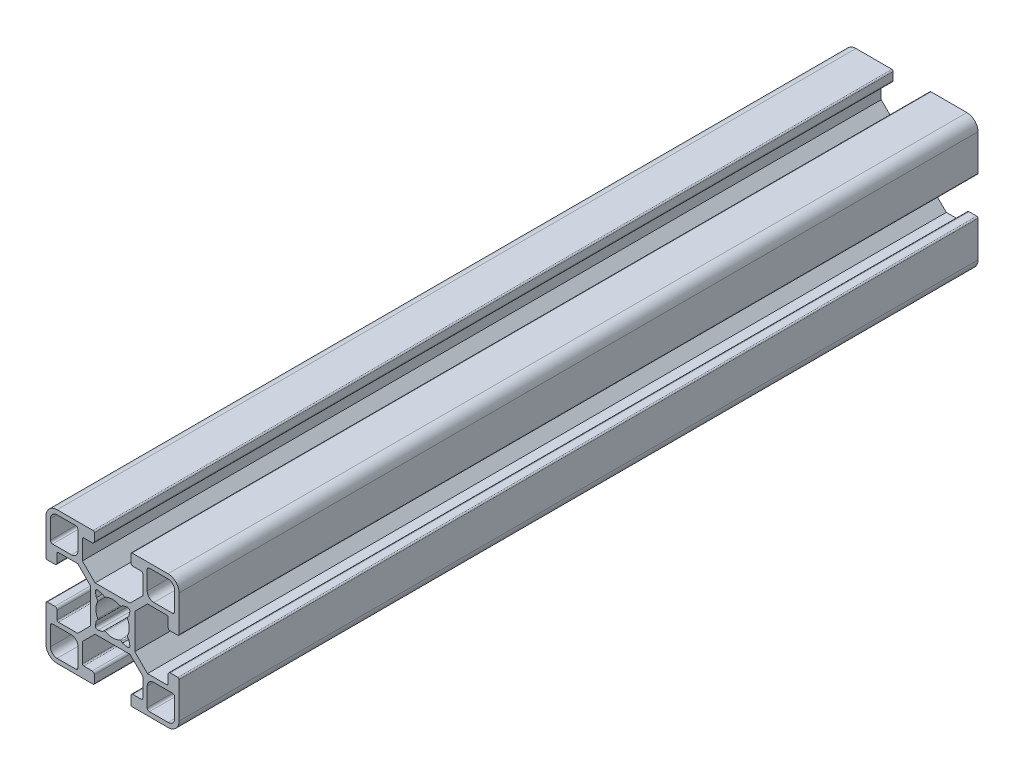
from build123d import *

# Parameters (mm, degrees)
BOSS_EXTRUDE1_DEPTH = 90


with BuildPart() as part:
    # Sketch1 → Boss-Extrude1 (new, symmetric)
    with BuildSketch(Plane.XY):
        with BuildLine():
            Line((21.799990977, 7.139350412), (18.939335294, 10.000004729))
            Line((18.939335294, 10.000004729), (11.060654294, 10.000000095))
            Line((11.060654294, 10.000000095), (8.200000977, 7.139342412))
            Line((8.200000977, 7.139342412), (8.200003529, 2.800001412))
            ThreePointArc((8.200003529, 2.800001412), (8.28786862, 2.587867672), (8.500000706, 2.499998588))
            Line((8.500000706, 2.499998588), (10.400000706, 2.499999706))
            ThreePointArc((10.400000706, 2.499999706), (10.753554287, 2.353553201), (10.900001, 1.999999706))
            Line((10.900001, 1.999999706), (10.900001, 0.299996823))
            ThreePointArc((10.900001, 0.299996823), (10.812134558, 0.087867732), (10.600006, 0))
            Line((10.600006, 0), (2.5, 0))
            ThreePointArc((2.5, 0), (0.732233047, 0.732233047), (0, 2.5))
            Line((0, 2.5), (0, 10.600006))
            ThreePointArc((0, 10.600006), (0.087869562, 10.812137388), (0.300003, 10.900002))
            Line((0.300003, 10.900002), (2, 10.900002))
            ThreePointArc((2, 10.900002), (2.353553391, 10.753555391), (2.5, 10.400002))
            Line((2.5, 10.400002), (2.5, 8.500002))
            ThreePointArc((2.5, 8.500002), (2.587869099, 8.287870075), (2.80000269, 8.200005))
            Line((2.80000269, 8.200005), (7.139344, 8.200005))
            Line((7.139344, 8.200005), (10, 11.06066))
            Line((10, 11.06066), (10, 18.939341))
            Line((10, 18.939341), (7.139344, 21.799995))
            Line((7.139344, 21.799995), (2.800003, 21.799995))
            ThreePointArc((2.800003, 21.799995), (2.587869208, 21.712130034), (2.5, 21.499998))
            Line((2.5, 21.499998), (2.5, 19.59999775))
            ThreePointArc((2.5, 19.59999775), (2.353553161, 19.246444027), (1.999999309, 19.0999975))
            Line((1.999999309, 19.0999975), (0.299996735, 19.099999))
            ThreePointArc((0.299996735, 19.099999), (0.087867778, 19.187865661), (2.65e-07, 19.399994265))
            Line((2.65e-07, 19.399994265), (2.65e-07, 27.500000265))
            ThreePointArc((2.65e-07, 27.500000265), (0.732233312, 29.267767218), (2.500000265, 30.000000265))
            Line((2.500000265, 30.000000265), (10.6000062, 30.000000265))
            ThreePointArc((10.6000062, 30.000000265), (10.812136906, 29.912130185), (10.900001, 29.699997))
            Line((10.900001, 29.699997), (10.900001, 28))
            ThreePointArc((10.900001, 28), (10.75355439, 27.646446609), (10.400001, 27.5))
            Line((10.400001, 27.5), (8.499999, 27.5))
            ThreePointArc((8.499999, 27.5), (8.287868368, 27.412130194), (8.200004, 27.19999731))
            Line((8.200004, 27.19999731), (8.200004, 22.860655))
            Line((8.200004, 22.860655), (11.060659, 20))
            Line((11.060659, 20), (18.93934, 20))
            Line((18.93934, 20), (21.799994, 22.860655))
            Line((21.799994, 22.860655), (21.799994, 27.199997))
            ThreePointArc((21.799994, 27.199997), (21.712129034, 27.412130792), (21.499997, 27.5))
            Line((21.499997, 27.5), (19.599981706, 27.5))
            ThreePointArc((19.599981706, 27.5), (19.246428419, 27.646446505), (19.099981706, 27.999999706))
            Line((19.099981706, 27.999999706), (19.099980706, 29.700007823))
            ThreePointArc((19.099980706, 29.700007823), (19.187847107, 29.912137435), (19.399976029, 30.0000055))
            Line((19.399976029, 30.0000055), (27.499982029, 30.0000055))
            ThreePointArc((27.499982029, 30.0000055), (29.267764732, 29.267777107), (30.0000055, 27.499999529))
            Line((30.0000055, 27.499999529), (30.0000055, 19.399993594))
            ThreePointArc((30.0000055, 19.399993594), (29.912142492, 19.187844223), (29.6999965, 19.099973058))
            Line((29.6999965, 19.099973058), (27.9999995, 19.099974558))
            ThreePointArc((27.9999995, 19.099974558), (27.646437821, 19.246429455), (27.4999995, 19.599998))
            Line((27.4999995, 19.599998), (27.4999995, 21.5))
            ThreePointArc((27.4999995, 21.5), (27.412129694, 21.712130632), (27.19999681, 21.799995))
            Line((27.19999681, 21.799995), (22.8606545, 21.799995))
            Line((22.8606545, 21.799995), (19.9999995, 18.939341))
            Line((19.9999995, 18.939341), (19.9999995, 11.06066))
            Line((19.9999995, 11.06066), (22.8606545, 8.200005))
            Line((22.8606545, 8.200005), (27.1999965, 8.200005))
            ThreePointArc((27.1999965, 8.200005), (27.412129603, 8.287869277), (27.4999995, 8.500000051))
            Line((27.4999995, 8.500000051), (27.4999995, 10.400002))
            ThreePointArc((27.4999995, 10.400002), (27.646446109, 10.753555391), (27.9999995, 10.900002))
            Line((27.9999995, 10.900002), (29.7000025, 10.900002))
            ThreePointArc((29.7000025, 10.900002), (29.912129264, 10.812133269), (29.999995, 10.600005265))
            Line((29.999995, 10.600005265), (29.999995, 2.499999265))
            ThreePointArc((29.999995, 2.499999265), (29.26776322, 0.732236385), (27.500000177, 5e-06))
            Line((27.500000177, 5e-06), (19.399994245, 5e-06))
            ThreePointArc((19.399994245, 5e-06), (19.187862761, 0.087874413), (19.099998, 0.300007824))
            Line((19.099998, 0.300007824), (19.099997, 2.000004824))
            ThreePointArc((19.099997, 2.000004824), (19.246443401, 2.3535583), (19.599996706, 2.500005118))
            Line((19.599996706, 2.500005118), (21.499998706, 2.500006235))
            ThreePointArc((21.499998706, 2.500006235), (21.712129286, 2.587876166), (21.799993529, 2.800009102))
            Line((21.799993529, 2.800009102), (21.799990977, 7.139350412))
        make_face()
        with BuildLine():
            Line((18.878868942, 11.714100014), (18.657285002, 12.75690673))
            Line((18.657285002, 12.75690673), (18.419345869, 12.994846743))
            ThreePointArc((18.419345869, 12.994846743), (18.335473622, 13.158180995), (18.362480424, 13.339793948))
            ThreePointArc((18.362480424, 13.339793948), (18.750006156, 14.99998656), (18.362487962, 16.660180933))
            ThreePointArc((18.362487962, 16.660180933), (18.335481889, 16.841794157), (18.419354758, 17.005128271))
            Line((18.419354758, 17.005128271), (18.657294593, 17.243067582))
            Line((18.657294593, 17.243067582), (18.878893628, 18.28587109))
            ThreePointArc((18.878893628, 18.28587109), (18.743367928, 18.743355263), (18.285883756, 18.878880962))
            Line((18.285883756, 18.878880962), (17.243080247, 18.657281928))
            Line((17.243080247, 18.657281928), (17.005140412, 18.419342617))
            ThreePointArc((17.005140412, 18.419342617), (16.84180664, 18.335470316), (16.660194009, 18.362476539))
            ThreePointArc((16.660194009, 18.362476539), (15.00000526, 18.749996344), (13.339816433, 18.362476869))
            ThreePointArc((13.339816433, 18.362476869), (13.158203164, 18.335470716), (12.994869031, 18.419343671))
            Line((12.994869031, 18.419343671), (12.756929898, 18.657283684))
            Line((12.756929898, 18.657283684), (11.714126233, 18.878881984))
            ThreePointArc((11.714126233, 18.878881984), (11.256641967, 18.743355772), (11.121116891, 18.28587117))
            Line((11.121116891, 18.28587117), (11.342717777, 17.243068055))
            Line((11.342717777, 17.243068055), (11.580656587, 17.00512772))
            ThreePointArc((11.580656587, 17.00512772), (11.664528478, 16.841794182), (11.637522309, 16.660181943))
            ThreePointArc((11.637522309, 16.660181943), (11.250003617, 14.999998075), (11.637519652, 13.339813587))
            ThreePointArc((11.637519652, 13.339813587), (11.664525497, 13.15820068), (11.580652734, 12.994866901))
            Line((11.580652734, 12.994866901), (11.342712898, 12.75692759))
            Line((11.342712898, 12.75692759), (11.12111194, 11.71412449))
            ThreePointArc((11.12111194, 11.71412449), (11.256636795, 11.256640068), (11.714120718, 11.121113524))
            Line((11.714120718, 11.121113524), (12.756924635, 11.342710635))
            Line((12.756924635, 11.342710635), (12.99486447, 11.580649946))
            ThreePointArc((12.99486447, 11.580649946), (13.158198441, 11.66452228), (13.339811235, 11.637515845))
            ThreePointArc((13.339811235, 11.637515845), (14.999988879, 11.249993804), (16.660169832, 11.637501672))
            ThreePointArc((16.660169832, 11.637501672), (16.841782614, 11.664506717), (17.005115943, 11.580633605))
            Line((17.005115943, 11.580633605), (17.243054753, 11.34269327))
            Line((17.243054753, 11.34269327), (18.285858839, 11.12109695))
            ThreePointArc((18.285858839, 11.12109695), (18.743339639, 11.256620822), (18.878868942, 11.714100014))
        make_face(mode=Mode.SUBTRACT)
        with BuildLine():
            Line((23.299995, 1), (27.5, 1))
            ThreePointArc((27.5, 1), (28.560660172, 1.439339828), (29, 2.5))
            Line((29, 2.5), (29, 6.700005))
            ThreePointArc((29, 6.700005), (28.853553391, 7.053558391), (28.5, 7.200005))
            Line((28.5, 7.200005), (24.299995, 7.200005))
            ThreePointArc((24.299995, 7.200005), (23.239334828, 6.760665172), (22.799995, 5.700005))
            Line((22.799995, 5.700005), (22.799995, 1.5))
            ThreePointArc((22.799995, 1.5), (22.946441609, 1.146446609), (23.299995, 1))
        make_face(mode=Mode.SUBTRACT)
        with BuildLine():
            Line((2.5, 1), (6.700005, 1))
            ThreePointArc((6.700005, 1), (7.05355839, 1.146446609), (7.200005, 1.5))
            Line((7.200005, 1.5), (7.200005, 5.700005))
            ThreePointArc((7.200005, 5.700005), (6.760665172, 6.760665172), (5.700005, 7.200005))
            Line((5.700005, 7.200005), (1.5, 7.200005))
            ThreePointArc((1.5, 7.200005), (1.146446609, 7.053558391), (1, 6.700005))
            Line((1, 6.700005), (1, 2.5))
            ThreePointArc((1, 2.5), (1.439339828, 1.439339828), (2.5, 1))
        make_face(mode=Mode.SUBTRACT)
        with BuildLine():
            Line((1.500000265, 22.799995265), (5.700005, 22.799995265))
            ThreePointArc((5.700005, 22.799995265), (6.760665172, 23.239335093), (7.200005, 24.299995265))
            Line((7.200005, 24.299995265), (7.200005, 28.500000265))
            ThreePointArc((7.200005, 28.500000265), (7.053558484, 28.853553562), (6.700005265, 29.000000265))
            Line((6.700005265, 29.000000265), (2.500000265, 29.000000265))
            ThreePointArc((2.500000265, 29.000000265), (1.439340093, 28.560660437), (1.000000265, 27.500000265))
            Line((1.000000265, 27.500000265), (1.000000265, 23.299995265))
            ThreePointArc((1.000000265, 23.299995265), (1.146446874, 22.946441874), (1.500000265, 22.799995265))
        make_face(mode=Mode.SUBTRACT)
        with BuildLine():
            Line((24.299995265, 22.799995265), (28.500000265, 22.799995265))
            ThreePointArc((28.500000265, 22.799995265), (28.853553655, 22.946441874), (29.000000265, 23.299995265))
            Line((29.000000265, 23.299995265), (29.000000265, 27.500000265))
            ThreePointArc((29.000000265, 27.500000265), (28.560660437, 28.560660437), (27.500000265, 29.000000265))
            Line((27.500000265, 29.000000265), (23.299995265, 29.000000265))
            ThreePointArc((23.299995265, 29.000000265), (22.946441874, 28.853553655), (22.799995265, 28.500000265))
            Line((22.799995265, 28.500000265), (22.799995265, 24.299995265))
            ThreePointArc((22.799995265, 24.299995265), (23.239335093, 23.239335093), (24.299995265, 22.799995265))
        make_face(mode=Mode.SUBTRACT)
    extrude(amount=BOSS_EXTRUDE1_DEPTH, both=True)


solid = part.part
